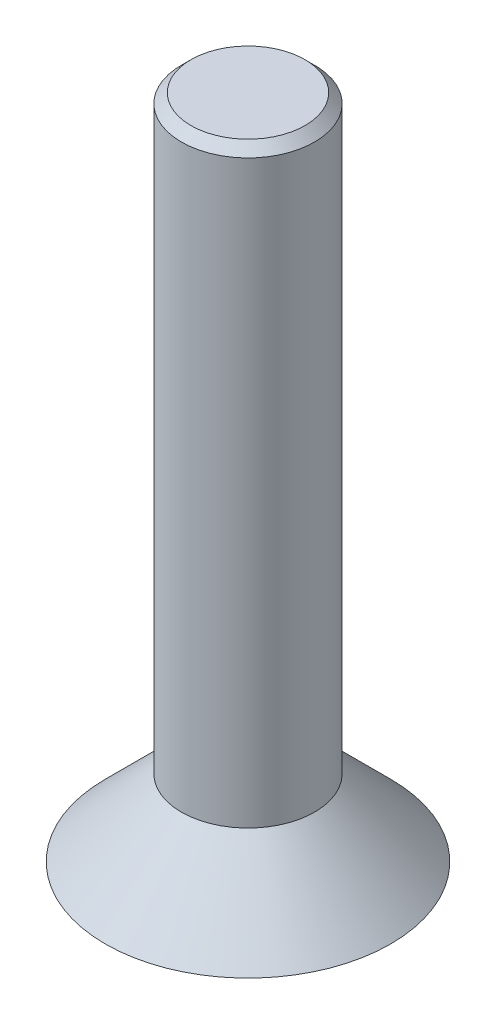
from build123d import *

# Parameters (mm, degrees)
SKETCH_1_R      = 3
EXTRUDE_1_DEPTH = 1.6
CHAMFER_1_SIZE  = 1.6
SKETCH_2_R      = 1.4
EXTRUDE_2_DEPTH = 12.4
CHAMFER_2_SIZE  = 0.2


with BuildPart() as part:
    # 草图1 → 凸台-拉伸1 (new body)
    with BuildSketch(Plane(origin=(0, 0, 0), x_dir=(1, 0, 0), z_dir=(0, 1, 0))):
        with Locations(Location((0, 0, 0), (0, 0, 270))):
            Circle(SKETCH_1_R)
        Polygon((0, -1.154700538), (1, -0.577350269), (1, 0.577350269), (0, 1.154700538), (-1, 0.577350269), (-1, -0.577350269), align=None, mode=Mode.SUBTRACT)
    extrude(amount=EXTRUDE_1_DEPTH)

    # 倒角1
    # the kernel refuses this chamfer: 1.6 mm, written as the material it takes off along each edge
    with BuildSketch(Plane(origin=(0, 1.6, 0), x_dir=(0, 0, 1), z_dir=(-1, 0, 0))) as chamfer_1_piece_1:
        Polygon((3, -CHAMFER_1_SIZE), (3 - CHAMFER_1_SIZE, 0), (3, 0), align=None)
    revolve(axis=Axis((0, 1.6, 0), (0, 1, 0)), mode=Mode.SUBTRACT)

    # 草图2 → 凸台-拉伸2 (add)
    with BuildSketch(Plane(origin=(0, 1.6, 0), x_dir=(1, 0, 0), z_dir=(0, 1, 0))):
        with Locations(Location((0, 0, 0), (0, 0, 270))):
            Circle(SKETCH_2_R)
    extrude(amount=EXTRUDE_2_DEPTH)

    # 倒角2
    chamfer_2_edges = [part.edges().sort_by_distance(p)[0] for p in [
        (0, 14, -1.4),
    ]]
    chamfer(chamfer_2_edges, length=CHAMFER_2_SIZE)


solid = part.part
